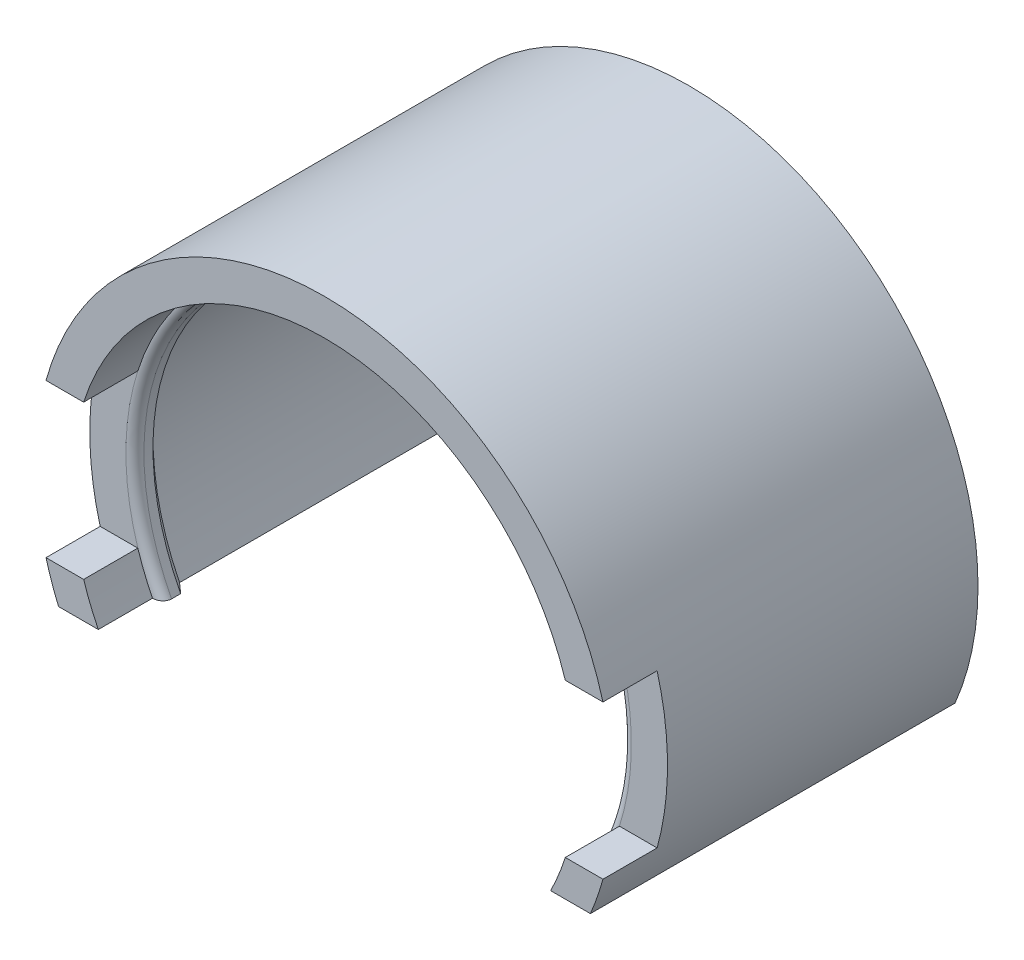
from build123d import *

# Parameters (mm, degrees)
BOSS_EXTRUDE1_DEPTH = 19.2
BOSS_EXTRUDE2_START = -1
BOSS_EXTRUDE2_DEPTH = 1
SKETCH2_W           = 35
SKETCH2_H           = 8.5
CUT_EXTRUDE1_DEPTH  = 3
BOSS_EXTRUDE3_START = -1
BOSS_EXTRUDE3_DEPTH = 1
CHAMFER1_SIZE       = 0.5


with BuildPart() as part:
    # Sketch1 → Boss-Extrude1 (new body)
    with BuildSketch(Plane.XY):
        with BuildLine():
            ThreePointArc((16, 0), (-3.188983134, 15.67897913), (-14.728798322, -6.25))
            Line((-14.728798322, -6.25), (-12.527469816, -6.25))
            ThreePointArc((-12.527469816, -6.25), (-3.210562456, 13.626895784), (14, 0))
            ThreePointArc((14, 0), (13.626895784, -3.210562456), (12.527469816, -6.25))
            Line((12.527469816, -6.25), (14.728798322, -6.25))
            ThreePointArc((14.728798322, -6.25), (15.67897913, -3.188983134), (16, 0))
        make_face()
    extrude(amount=BOSS_EXTRUDE1_DEPTH)

    # Sketch1<3> → Boss-Extrude2 (add)
    with BuildSketch(Plane.XY.offset(BOSS_EXTRUDE2_START)):
        with BuildLine():
            ThreePointArc((14, 0), (-3.210562456, 13.626895784), (-12.527469816, -6.25))
            Line((-12.527469816, -6.25), (12.527469816, -6.25))
            ThreePointArc((12.527469816, -6.25), (13.626895784, -3.210562456), (14, 0))
        make_face()
        with BuildLine():
            ThreePointArc((16, 0), (-3.188983134, 15.67897913), (-14.728798322, -6.25))
            Line((-14.728798322, -6.25), (-12.527469816, -6.25))
            ThreePointArc((-12.527469816, -6.25), (-3.210562456, 13.626895784), (14, 0))
            ThreePointArc((14, 0), (13.626895784, -3.210562456), (12.527469816, -6.25))
            Line((12.527469816, -6.25), (14.728798322, -6.25))
            ThreePointArc((14.728798322, -6.25), (15.67897913, -3.188983134), (16, 0))
        make_face()
    extrude(amount=BOSS_EXTRUDE2_DEPTH)

    # Sketch2 → Cut-Extrude1 (cut)
    with BuildSketch(Plane.XY.offset(19.2)):
        Rectangle(SKETCH2_W, SKETCH2_H)
    extrude(amount=-CUT_EXTRUDE1_DEPTH, mode=Mode.SUBTRACT)

    # Sketch3 → Boss-Extrude3 (add)
    with BuildSketch(Plane.XY.offset(16.2).offset(BOSS_EXTRUDE3_START)):
        with BuildLine():
            ThreePointArc((13.339321572, 4.25), (-5.265669551, 12.971997694), (-12.527469816, -6.25))
            Line((-12.527469816, -6.25), (-11.966097944, -6.25))
            ThreePointArc((-11.966097944, -6.25), (-3.217738162, 13.110917631), (13.5, 0))
            ThreePointArc((13.5, 0), (13.110917631, -3.217738162), (11.966097944, -6.25))
            Line((11.966097944, -6.25), (12.527469816, -6.25))
            ThreePointArc((12.527469816, -6.25), (12.971997694, -5.265669551), (13.339321572, -4.25))
            ThreePointArc((13.339321572, -4.25), (13.833844404, -2.150522959), (14, 0))
            ThreePointArc((14, 0), (13.833844404, 2.150522959), (13.339321572, 4.25))
        make_face()
    extrude(amount=BOSS_EXTRUDE3_DEPTH)

    # Fillet1: read off the stored shape, not the designer's step
    # Fillet1 outline → Fillet1 (revolve, cut)
    with BuildSketch(Plane.XZ):
        with BuildLine():
            Line((13.5, 16.2), (13.5, 15.7))
            ThreePointArc((13.5, 15.7), (13.646446609, 16.053553391), (14, 16.2))
            Line((14, 16.2), (13.5, 16.2))
        make_face()
    revolve(axis=Axis((0, 0, 0), (0, 0, 1)), mode=Mode.SUBTRACT)

    # Chamfer1
    chamfer1_edges = [part.edges().sort_by_distance(p)[0] for p in [
        (-3.210562456, 13.626895784, 15.2),
    ]]
    chamfer(chamfer1_edges, length=CHAMFER1_SIZE - 0.0001)  # a hair under: the kernel refuses the full size


solid = part.part
